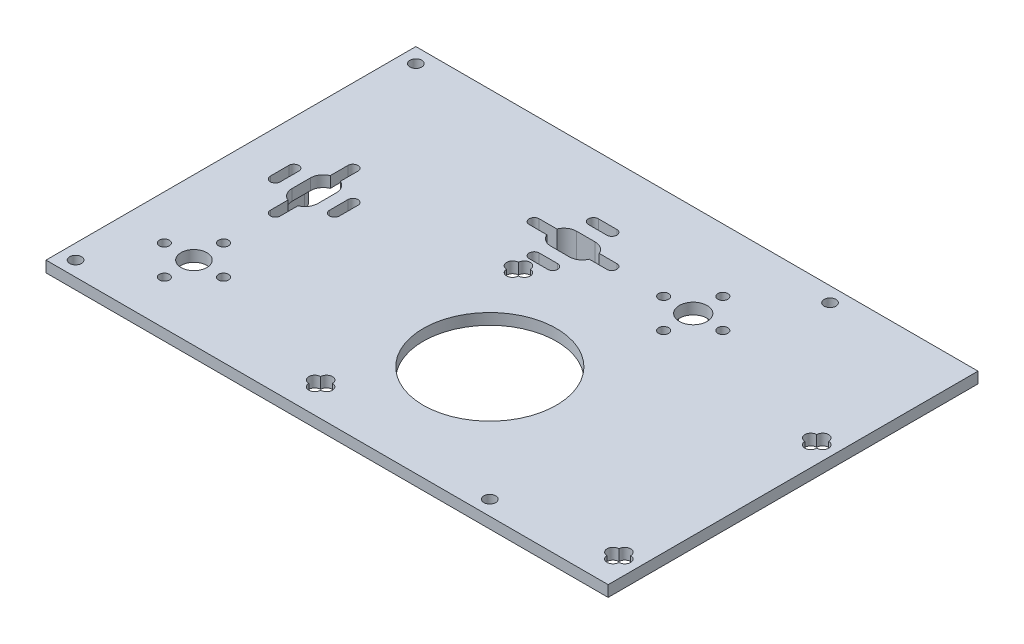
from build123d import *

# Parameters (mm, degrees)
SKETCH1_W           = 120
SKETCH1_H           = 100
BOSS_EXTRUDE1_DEPTH = 3
SKETCH2_R           = 1.35
CUT_EXTRUDE1_DEPTH  = 4
SKETCH3_R           = 18
CUT_EXTRUDE2_DEPTH  = 10
CUT_EXTRUDE3_DEPTH  = 10
SKETCH5_R           = 1.6
CUT_EXTRUDE5_DEPTH  = 10
SKETCH6_R           = 3.5
SKETCH6_R_2         = 3.75
CUT_EXTRUDE6_DEPTH  = 10
SKETCH9_W           = 100
SKETCH9_H           = 3
BOSS_EXTRUDE2_DEPTH = 32
SKETCH8_R           = 1.6
CUT_EXTRUDE8_DEPTH  = 10
CUT_EXTRUDE9_DEPTH  = 60
SKETCH11_R          = 2.85
SKETCH11_R_2        = 1.35
BOSS_EXTRUDE3_DEPTH = 5


with BuildPart() as part:
    # Sketch1 → Boss-Extrude1 (new body)
    with BuildSketch(Plane(origin=(0, 0, 0), x_dir=(1, 0, 0), z_dir=(0, 1, 0))):
        Rectangle(SKETCH1_W, SKETCH1_H)
    extrude(amount=BOSS_EXTRUDE1_DEPTH)

    # Sketch2 → Cut-Extrude1 (cut)
    with BuildSketch(Plane(origin=(0, 3, 0), x_dir=(1, 0, 0), z_dir=(0, 1, 0))):
        with Locations((18, 25)):
            Circle(SKETCH2_R)
        with Locations((48, 25)):
            Circle(SKETCH2_R)
        with Locations((-40, -8)):
            Circle(SKETCH2_R)
        with Locations((-40, -38)):
            Circle(SKETCH2_R)
        with Locations((10, 17)):
            Circle(SKETCH2_R)
        with Locations((2, 25)):
            Circle(SKETCH2_R)
        with Locations((10, 33)):
            Circle(SKETCH2_R)
        with Locations((40, 17)):
            Circle(SKETCH2_R)
        with Locations((32, 25)):
            Circle(SKETCH2_R)
        with Locations((40, 33)):
            Circle(SKETCH2_R)
        with Locations((-48, -30)):
            Circle(SKETCH2_R)
        with Locations((-40, -22)):
            Circle(SKETCH2_R)
        with Locations((-32, -30)):
            Circle(SKETCH2_R)
        with Locations((-48, 0)):
            Circle(SKETCH2_R)
        with Locations((-40, 8)):
            Circle(SKETCH2_R)
        with Locations((-32, 0)):
            Circle(SKETCH2_R)
    extrude(amount=-CUT_EXTRUDE1_DEPTH, mode=Mode.SUBTRACT)

    # Sketch3 → Cut-Extrude2 (cut)
    with BuildSketch(Plane(origin=(0, 3, 0), x_dir=(1, 0, 0), z_dir=(0, 1, 0))):
        with Locations((25, -15)):
            Circle(SKETCH3_R)
    extrude(amount=-CUT_EXTRUDE2_DEPTH, mode=Mode.SUBTRACT)

    # Sketch4 → Cut-Extrude3 (cut)
    with BuildSketch(Plane(origin=(0, 3, 0), x_dir=(1, 0, 0), z_dir=(0, 1, 0))):
        with BuildLine():
            Line((-41.35, -8), (-41.35, -3))
            ThreePointArc((-41.35, -3), (-40, -1.65), (-38.65, -3))
            Line((-38.65, -3), (-38.65, -8))
            ThreePointArc((-38.65, -8), (-40, -9.35), (-41.35, -8))
        make_face()
        with BuildLine():
            Line((-33.35, 0), (-33.35, 5))
            ThreePointArc((-33.35, 5), (-32, 6.35), (-30.65, 5))
            Line((-30.65, 5), (-30.65, 0))
            ThreePointArc((-30.65, 0), (-32, -1.35), (-33.35, 0))
        make_face()
        with BuildLine():
            Line((-41.35, 8), (-41.35, 13))
            ThreePointArc((-41.35, 13), (-40, 14.35), (-38.65, 13))
            Line((-38.65, 13), (-38.65, 8))
            ThreePointArc((-38.65, 8), (-40, 6.65), (-41.35, 8))
        make_face()
        with BuildLine():
            Line((-49.35, 0), (-49.35, 5))
            ThreePointArc((-49.35, 5), (-48, 6.35), (-46.65, 5))
            Line((-46.65, 5), (-46.65, 0))
            ThreePointArc((-46.65, 0), (-48, -1.35), (-49.35, 0))
        make_face()
        with BuildLine():
            Line((2, 23.65), (-3, 23.65))
            ThreePointArc((-3, 23.65), (-4.35, 25), (-3, 26.35))
            Line((-3, 26.35), (2, 26.35))
            ThreePointArc((2, 26.35), (3.35, 25), (2, 23.65))
        make_face()
        with BuildLine():
            Line((10, 31.65), (5, 31.65))
            ThreePointArc((5, 31.65), (3.65, 33), (5, 34.35))
            Line((5, 34.35), (10, 34.35))
            ThreePointArc((10, 34.35), (11.35, 33), (10, 31.65))
        make_face()
        with BuildLine():
            Line((18, 23.65), (13, 23.65))
            ThreePointArc((13, 23.65), (11.65, 25), (13, 26.35))
            Line((13, 26.35), (18, 26.35))
            ThreePointArc((18, 26.35), (19.35, 25), (18, 23.65))
        make_face()
        with BuildLine():
            Line((10, 15.65), (5, 15.65))
            ThreePointArc((5, 15.65), (3.65, 17), (5, 18.35))
            Line((5, 18.35), (10, 18.35))
            ThreePointArc((10, 18.35), (11.35, 17), (10, 15.65))
        make_face()
    extrude(amount=-CUT_EXTRUDE3_DEPTH, mode=Mode.SUBTRACT)

    # Sketch5 → Cut-Extrude5 (cut)
    with BuildSketch(Plane(origin=(0, 3, 0), x_dir=(1, 0, 0), z_dir=(0, 1, 0))):
        with Locations((-56, 46)):
            Circle(SKETCH5_R)
        with Locations((56, 46)):
            Circle(SKETCH5_R)
        with Locations((56, -46)):
            Circle(SKETCH5_R)
        with Locations((-56, -46)):
            Circle(SKETCH5_R)
    extrude(amount=-CUT_EXTRUDE5_DEPTH, mode=Mode.SUBTRACT)

    # Sketch6 → Cut-Extrude6 (cut)
    with BuildSketch(Plane(origin=(0, 3, 0), x_dir=(1, 0, 0), z_dir=(0, 1, 0))):
        with Locations((-40, -30)):
            Circle(SKETCH6_R)
        with Locations((40, 25)):
            Circle(SKETCH6_R_2)
        with BuildLine():
            Line((-43.5, 0), (-43.5, 5))
            ThreePointArc((-43.5, 5), (-40, 8.5), (-36.5, 5))
            Line((-36.5, 5), (-36.5, 0))
            ThreePointArc((-36.5, 0), (-40, -3.5), (-43.5, 0))
        make_face()
        with BuildLine():
            Line((10, 21.5), (5, 21.5))
            ThreePointArc((5, 21.5), (1.5, 25), (5, 28.5))
            Line((5, 28.5), (10, 28.5))
            ThreePointArc((10, 28.5), (13.5, 25), (10, 21.5))
        make_face()
    extrude(amount=-CUT_EXTRUDE6_DEPTH, mode=Mode.SUBTRACT)

    # Sketch9 → Boss-Extrude2 (add)
    with BuildSketch(Plane(origin=(60, 0, 0), x_dir=(0, 0, -1), z_dir=(1, 0, 0))):
        with Locations((0, 1.5)):
            Rectangle(SKETCH9_W, SKETCH9_H)
    extrude(amount=BOSS_EXTRUDE2_DEPTH)

    # Sketch8 → Cut-Extrude8 (cut)
    with BuildSketch(Plane.XZ):
        with Locations((6, -11.75)):
            Circle(SKETCH8_R)
        with Locations((6, 41.75)):
            Circle(SKETCH8_R)
        with Locations((86.65, 41.75)):
            Circle(SKETCH8_R)
        with Locations((86.65, -11.75)):
            Circle(SKETCH8_R)
    extrude(amount=-CUT_EXTRUDE8_DEPTH, mode=Mode.SUBTRACT)

    # Sketch10 → Cut-Extrude9 (cut)
    with BuildSketch(Plane.XZ):
        with BuildLine():
            ThreePointArc((4.4, 43.35), (2.8, 41.75), (4.4, 40.15))
            ThreePointArc((4.4, 40.15), (6, 38.55), (7.6, 40.15))
            ThreePointArc((7.6, 40.15), (9.2, 41.75), (7.6, 43.35))
            ThreePointArc((7.6, 43.35), (6, 44.95), (4.4, 43.35))
        make_face()
        with BuildLine():
            ThreePointArc((4.4, -13.35), (6, -14.95), (7.6, -13.35))
            ThreePointArc((7.6, -13.35), (9.2, -11.75), (7.6, -10.15))
            ThreePointArc((7.6, -10.15), (6, -8.55), (4.4, -10.15))
            ThreePointArc((4.4, -10.15), (2.8, -11.75), (4.4, -13.35))
        make_face()
        with BuildLine():
            ThreePointArc((85.05, -13.35), (86.65, -14.95), (88.25, -13.35))
            ThreePointArc((88.25, -13.35), (89.85, -11.75), (88.25, -10.15))
            ThreePointArc((88.25, -10.15), (86.65, -8.55), (85.05, -10.15))
            ThreePointArc((85.05, -10.15), (83.45, -11.75), (85.05, -13.35))
        make_face()
        with BuildLine():
            ThreePointArc((88.25, 43.35), (86.65, 44.95), (85.05, 43.35))
            ThreePointArc((85.05, 43.35), (83.45, 41.75), (85.05, 40.15))
            ThreePointArc((85.05, 40.15), (86.65, 38.55), (88.25, 40.15))
            ThreePointArc((88.25, 40.15), (89.85, 41.75), (88.25, 43.35))
        make_face()
    extrude(amount=-CUT_EXTRUDE9_DEPTH, mode=Mode.SUBTRACT)

    # Sketch11 → Boss-Extrude3 (add)
    # profile 1 of 11: a face of its own
    with BuildSketch(Plane.XZ):
        with Locations((-40, 22)):
            Circle(SKETCH11_R)
        with Locations((-40, 22)):
            Circle(SKETCH11_R_2, mode=Mode.SUBTRACT)
    # profile 2 of 11: a face of its own
    with BuildSketch(Plane.XZ):
        with Locations((-40, 38)):
            Circle(SKETCH11_R)
        with Locations((-40, 38)):
            Circle(SKETCH11_R_2, mode=Mode.SUBTRACT)
    # profile 3 of 11: a face of its own
    with BuildSketch(Plane.XZ):
        with Locations((-32, 30)):
            Circle(SKETCH11_R)
        with Locations((-32, 30)):
            Circle(SKETCH11_R_2, mode=Mode.SUBTRACT)
    # profile 4 of 11: a face of its own
    with BuildSketch(Plane.XZ):
        with Locations((-48, 30)):
            Circle(SKETCH11_R)
        with Locations((-48, 30)):
            Circle(SKETCH11_R_2, mode=Mode.SUBTRACT)
    # profile 5 of 11: a face of its own
    with BuildSketch(Plane.XZ):
        with Locations((48, -25)):
            Circle(SKETCH11_R)
        with Locations((48, -25)):
            Circle(SKETCH11_R_2, mode=Mode.SUBTRACT)
    # profile 6 of 11: a face of its own
    with BuildSketch(Plane.XZ):
        with Locations((40, -17)):
            Circle(SKETCH11_R)
        with Locations((40, -17)):
            Circle(SKETCH11_R_2, mode=Mode.SUBTRACT)
    # profile 7 of 11: a face of its own
    with BuildSketch(Plane.XZ):
        with Locations((32, -25)):
            Circle(SKETCH11_R)
        with Locations((32, -25)):
            Circle(SKETCH11_R_2, mode=Mode.SUBTRACT)
    # profile 8 of 11: a face of its own
    with BuildSketch(Plane.XZ):
        with Locations((40, -33)):
            Circle(SKETCH11_R)
        with Locations((40, -33)):
            Circle(SKETCH11_R_2, mode=Mode.SUBTRACT)
    # profile 9 of 11: a face of its own
    with BuildSketch(Plane.XZ):
        with BuildLine():
            Line((-50.85, -5), (-50.85, 0))
            ThreePointArc((-50.85, 0), (-48, 2.85), (-45.15, 0))
            Line((-45.15, 0), (-45.15, -5))
            ThreePointArc((-45.15, -5), (-48, -7.85), (-50.85, -5))
        make_face()
        with BuildLine():
            Line((-49.35, -5), (-49.35, 0))
            ThreePointArc((-49.35, 0), (-48, 1.35), (-46.65, 0))
            Line((-46.65, 0), (-46.65, -5))
            ThreePointArc((-46.65, -5), (-48, -6.35), (-49.35, -5))
        make_face(mode=Mode.SUBTRACT)
    # profile 10 of 11: a face of its own
    with BuildSketch(Plane.XZ):
        with BuildLine():
            Line((-34.85, -5), (-34.85, 0))
            ThreePointArc((-34.85, 0), (-32, 2.85), (-29.15, 0))
            Line((-29.15, 0), (-29.15, -5))
            ThreePointArc((-29.15, -5), (-32, -7.85), (-34.85, -5))
        make_face()
        with BuildLine():
            Line((-33.35, -5), (-33.35, 0))
            ThreePointArc((-33.35, 0), (-32, 1.35), (-30.65, 0))
            Line((-30.65, 0), (-30.65, -5))
            ThreePointArc((-30.65, -5), (-32, -6.35), (-33.35, -5))
        make_face(mode=Mode.SUBTRACT)
    # profile 11 of 11: a face of its own
    with BuildSketch(Plane.XZ):
        with BuildLine():
            Line((10, -20), (5, -20))
            ThreePointArc((5, -20), (2.681595376, -20.569988713), (0.89177654, -22.15))
            Line((0.89177654, -22.15), (-3, -22.15))
            ThreePointArc((-3, -22.15), (-5.85, -25), (-3, -27.85))
            Line((-3, -27.85), (0.89177654, -27.85))
            ThreePointArc((0.89177654, -27.85), (2.681595376, -29.430011287), (5, -30))
            Line((5, -30), (10, -30))
            ThreePointArc((10, -30), (12.318404624, -29.430011287), (14.10822346, -27.85))
            Line((14.10822346, -27.85), (18, -27.85))
            ThreePointArc((18, -27.85), (20.85, -25), (18, -22.15))
            Line((18, -22.15), (14.10822346, -22.15))
            ThreePointArc((14.10822346, -22.15), (12.318404624, -20.569988713), (10, -20))
        make_face()
        with BuildLine():
            Line((10, -21.5), (5, -21.5))
            ThreePointArc((5, -21.5), (3.060283526, -22.086668574), (1.770836022, -23.65))
            Line((1.770836022, -23.65), (-3, -23.65))
            ThreePointArc((-3, -23.65), (-4.35, -25), (-3, -26.35))
            Line((-3, -26.35), (1.770836022, -26.35))
            ThreePointArc((1.770836022, -26.35), (3.060283526, -27.913331426), (5, -28.5))
            Line((5, -28.5), (10, -28.5))
            ThreePointArc((10, -28.5), (11.939716474, -27.913331426), (13.229163978, -26.35))
            Line((13.229163978, -26.35), (18, -26.35))
            ThreePointArc((18, -26.35), (19.35, -25), (18, -23.65))
            Line((18, -23.65), (13.229163978, -23.65))
            ThreePointArc((13.229163978, -23.65), (11.939716474, -22.086668574), (10, -21.5))
        make_face(mode=Mode.SUBTRACT)
    extrude(amount=BOSS_EXTRUDE3_DEPTH)


solid = part.part
